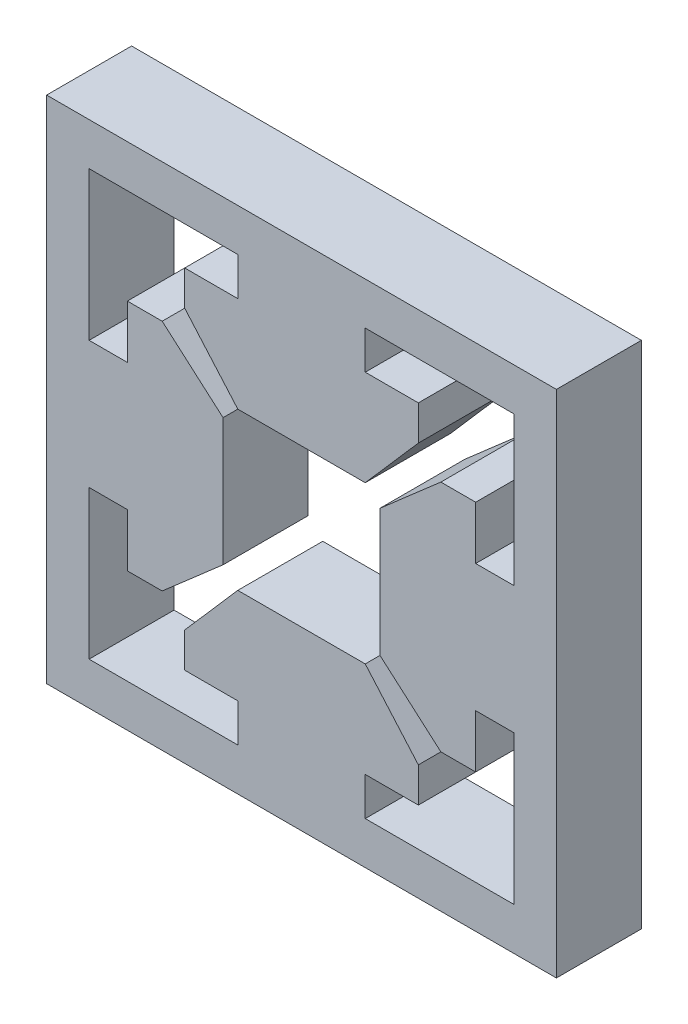
from build123d import *

# Parameters (mm, degrees)
SKETCH_1_W      = 24
SKETCH_1_H      = 24
EXTRUDE_1_DEPTH = 4


with BuildPart() as part:
    # Эскиз1 → Бобышка-Вытянуть1 (new body)
    with BuildSketch(Plane.XY):
        Rectangle(SKETCH_1_W, SKETCH_1_H)
        Polygon((3, 8.2), (3, 10), (10, 10), (10, 3), (8.2, 3), (8.2, 5.5), (6.56, 5.5), (3.693992791, 3), (3.693992791, -3), (6.56, -5.5), (8.2, -5.5), (8.2, -3), (10, -3), (10, -10), (3, -10), (3, -8.2), (5.5, -8.2), (5.5, -6.56), (3, -3.693992791), (-3, -3.693992791), (-5.5, -6.56), (-5.5, -8.2), (-3, -8.2), (-3, -10), (-10, -10), (-10, -3), (-8.2, -3), (-8.2, -5.5), (-6.56, -5.5), (-3.693992791, -3), (-3.693992791, 3), (-6.56, 5.5), (-8.2, 5.5), (-8.2, 3), (-10, 3), (-10, 10), (-3, 10), (-3, 8.2), (-5.5, 8.2), (-5.5, 6.56), (-3, 3.693992791), (3, 3.693992791), (5.5, 6.56), (5.5, 8.2), align=None, mode=Mode.SUBTRACT)
    extrude(amount=EXTRUDE_1_DEPTH)


solid = part.part
